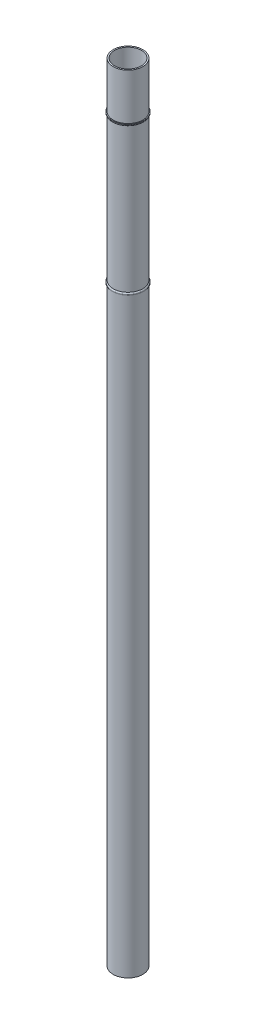
from build123d import *

# Parameters (mm, degrees)
SKETCH1_R           = 16
BOSS_EXTRUDE1_DEPTH = 850
SKETCH2_R           = 14.5
CUT_EXTRUDE1_DEPTH  = 848
BOSS_EXTRUDE2_START = -2
SKETCH3_R           = 17
SKETCH3_R_2         = 16
BOSS_EXTRUDE2_DEPTH = 2
FILLET1_R           = 1.5
SKETCH4_R           = 17
SKETCH4_R_2         = 16
BOSS_EXTRUDE3_DEPTH = 2
FILLET2_R           = 1.5


with BuildPart() as part:
    # Sketch1 → Boss-Extrude1 (new body)
    with BuildSketch(Plane(origin=(0, 0, 0), x_dir=(1, 0, 0), z_dir=(0, 1, 0))):
        with Locations(Location((0, 0, 0), (0, 0, 270))):
            Circle(SKETCH1_R)
    extrude(amount=BOSS_EXTRUDE1_DEPTH)

    # Sketch2 → Cut-Extrude1 (cut)
    with BuildSketch(Plane(origin=(0, 850, 0), x_dir=(1, 0, 0), z_dir=(0, 1, 0))):
        with Locations(Location((0, 0, 0), (0, 0, 270))):
            Circle(SKETCH2_R)
    extrude(amount=-CUT_EXTRUDE1_DEPTH, mode=Mode.SUBTRACT)

    # Sketch3 → Boss-Extrude2 (add)
    with BuildSketch(Plane(origin=(0, 800, 0), x_dir=(1, 0, 0), z_dir=(0, 1, 0)).offset(BOSS_EXTRUDE2_START)):
        with Locations(Location((0, 0, 0), (0, 0, 270))):
            Circle(SKETCH3_R)
        with Locations(Location((0, 0, 0), (0, 0, 270))):
            Circle(SKETCH3_R_2, mode=Mode.SUBTRACT)
    extrude(amount=BOSS_EXTRUDE2_DEPTH)

    # Fillet1
    # the kernel refuses this fillet: 1.5 mm, written as the material it takes off along each edge
    with BuildSketch(Plane(origin=(0, 798, 0), x_dir=(0, 0, 1), z_dir=(-1, 0, 0))) as fillet1_piece_1:
        with BuildLine():
            CenterArc((15.5, 1.414213562), FILLET1_R, 289.471220634, 70.528779366)
            Line((17, 1.414213562), (17.03, 1.414213562))
            Line((17.03, 1.414213562), (17.03, 0))
            Line((17.03, 0), (17, -0.03))
            ThreePointArc((17, -0.03), (16.5, -0.03), (16.01, -0.028284271))
            Line((16.01, -0.028284271), (16, 0))
        make_face()
    revolve(axis=Axis((0, 798, 0), (0, 1, 0)), mode=Mode.SUBTRACT)

    # Sketch4 → Boss-Extrude3 (add)
    with BuildSketch(Plane(origin=(0, 640, 0), x_dir=(1, 0, 0), z_dir=(0, 1, 0))):
        with Locations(Location((0, 0, 0), (0, 0, 270))):
            Circle(SKETCH4_R)
        with Locations(Location((0, 0, 0), (0, 0, 270))):
            Circle(SKETCH4_R_2, mode=Mode.SUBTRACT)
    extrude(amount=BOSS_EXTRUDE3_DEPTH)

    # Fillet2
    # the kernel refuses this fillet: 1.5 mm, written as the material it takes off along each edge
    with BuildSketch(Plane(origin=(0, 642, 0), x_dir=(0, 0, 1), z_dir=(-1, 0, 0))) as fillet2_piece_1:
        with BuildLine():
            CenterArc((15.5, -1.414213562), FILLET2_R, 0, 70.528779366)
            Line((16, 0), (16.01, 0.028284271))
            ThreePointArc((16.01, 0.028284271), (16.5, 0.03), (17, 0.03))
            Line((17, 0.03), (17.03, 0))
            Line((17.03, 0), (17.03, -1.414213562))
            Line((17.03, -1.414213562), (17, -1.414213562))
        make_face()
    revolve(axis=Axis((0, 642, 0), (0, 1, 0)), mode=Mode.SUBTRACT)


solid = part.part
